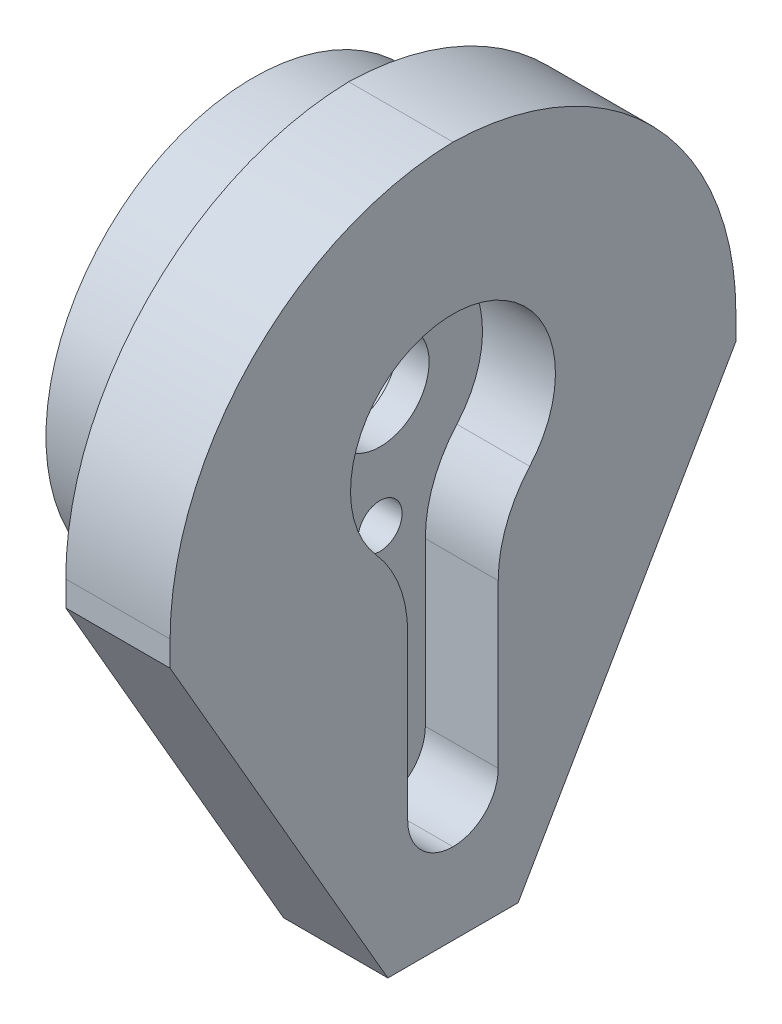
from build123d import *

# Parameters (mm, degrees)
SKETCH1_W           = 20
SKETCH1_H           = 20
BOSS_EXTRUDE1_DEPTH = 20
SKETCH2_W           = 45
SKETCH2_H           = 70
BOSS_EXTRUDE2_DEPTH = 8.3
CUT_EXTRUDE1_DEPTH  = 5.8
FILLET1_R           = 3.6
FILLET2_R           = 10
SKETCH5_R           = 3.9
CUT_EXTRUDE2_DEPTH  = 51.320373608
CUT_EXTRUDE3_REACH  = 49.302
SKETCH6_R           = 1.75
SKETCH13_W          = 20
SKETCH13_H          = 20
CUT_EXTRUDE9_DEPTH  = 20
SKETCH14_R          = 16.475
BOSS_EXTRUDE3_DEPTH = 7.6
SKETCH15_W          = 8.3
SKETCH15_H          = 45
CUT_EXTRUDE10_DEPTH = 15
FILLET3_R           = 23
CHAMFER1_SIZE       = 30
CHAMFER1_SIZE2      = 17.320508076
CHAMFER2_SIZE       = 30
CHAMFER2_SIZE2      = 17.320508076
SKETCH16_R          = 13.475
CUT_EXTRUDE11_DEPTH = 7.6
FILLET4_R           = 1


# Some blends are built 0.0001 mm under size
with BuildPart() as part:
    # Sketch1 → Boss-Extrude1 (new body)
    with BuildSketch(Plane(origin=(0, 0, 0), x_dir=(0, 0, -1), z_dir=(1, 0, 0))):
        Rectangle(SKETCH1_W, SKETCH1_H)
    extrude(amount=BOSS_EXTRUDE1_DEPTH)

    # Sketch2 → Boss-Extrude2 (add)
    with BuildSketch(Plane(origin=(20, 0, 0), x_dir=(0, 0, -1), z_dir=(1, 0, 0))):
        Rectangle(SKETCH2_W, SKETCH2_H)
    extrude(amount=BOSS_EXTRUDE2_DEPTH)

    # Sketch4 → Cut-Extrude1 (cut)
    with BuildSketch(Plane(origin=(28.3, 0, 0), x_dir=(0, 0, -1), z_dir=(1, 0, 0))):
        with BuildLine():
            Line((3.6, -28.55), (-3.6, -28.55))
            Line((-3.6, -28.55), (-3.6, -7.311805523))
            ThreePointArc((-3.6, -7.311805523), (0, 8.15), (3.6, -7.311805523))
            Line((3.6, -7.311805523), (3.6, -28.55))
        make_face()
    extrude(amount=-CUT_EXTRUDE1_DEPTH, mode=Mode.SUBTRACT)

    # Fillet1
    fillet1_edges = [part.edges().sort_by_distance(p)[0] for p in [
        (25.4, -28.55, 3.6),
        (25.4, -28.55, -3.6),
    ]]
    fillet(fillet1_edges, radius=FILLET1_R - 0.0001)  # a hair under: the kernel refuses the full size

    # Fillet2
    fillet2_edges = [part.edges().sort_by_distance(p)[0] for p in [
        (25.4, -7.311805523, 3.6),
        (25.4, -7.311805523, -3.6),
    ]]
    fillet(fillet2_edges, radius=FILLET2_R)

    # Sketch5 → Cut-Extrude2 (cut, through all)
    with BuildSketch(Plane.ZY):
        Circle(SKETCH5_R)
    extrude(amount=-CUT_EXTRUDE2_DEPTH, mode=Mode.SUBTRACT)

    # Sketch6 → Cut-Extrude3 (cut, up to next)
    with BuildSketch(Plane(origin=(22.5, 0, 0), x_dir=(0, 0, -1), z_dir=(1, 0, 0)), mode=Mode.PRIVATE) as cut_extrude3_sk1:
        with Locations((0, -20.6)):
            Circle(SKETCH6_R)
    cut_extrude3_tool1 = extrude(cut_extrude3_sk1.sketch, amount=-CUT_EXTRUDE3_REACH, mode=Mode.PRIVATE) & part.part
    # Sketch6 → Cut-Extrude3 (cut, up to next)
    with BuildSketch(Plane(origin=(22.5, 0, 0), x_dir=(0, 0, -1), z_dir=(1, 0, 0)), mode=Mode.PRIVATE) as cut_extrude3_sk2:
        with Locations((0, -9.35)):
            Circle(SKETCH6_R)
    cut_extrude3_tool2 = extrude(cut_extrude3_sk2.sketch, amount=-CUT_EXTRUDE3_REACH, mode=Mode.PRIVATE) & part.part
    add(cut_extrude3_tool1.solids().sort_by_distance((22.5, -20.6, 0))[0], mode=Mode.SUBTRACT)
    add(cut_extrude3_tool2.solids().sort_by_distance((22.5, -9.35, 0))[0], mode=Mode.SUBTRACT)

    # Sketch13 → Cut-Extrude9 (cut)
    with BuildSketch(Plane.ZY):
        Rectangle(SKETCH13_W, SKETCH13_H)
    extrude(amount=-CUT_EXTRUDE9_DEPTH, mode=Mode.SUBTRACT)

    # Sketch14 → Boss-Extrude3 (add)
    with BuildSketch(Plane.ZY.offset(-20)):
        with Locations(Location((0, 0, 0), (0, 0, 180))):
            Circle(SKETCH14_R)
    extrude(amount=BOSS_EXTRUDE3_DEPTH)

    # Sketch15 → Cut-Extrude10 (cut)
    with BuildSketch(Plane(origin=(0, 35, 0), x_dir=(1, 0, 0), z_dir=(0, 1, 0))):
        with Locations((24.15, 0)):
            Rectangle(SKETCH15_W, SKETCH15_H)
    extrude(amount=-CUT_EXTRUDE10_DEPTH, mode=Mode.SUBTRACT)

    # Fillet3
    # the kernel refuses this fillet: 23 mm, written as the material it takes off along each edge
    with BuildSketch(Plane(origin=(-37.5, 20, -22.5), x_dir=(0, -1, 0), z_dir=(1, 0, 0)), Plane(origin=(85.8, 20, 22.5), x_dir=(0, -1, 0), z_dir=(-1, 0, 0))) as fillet3_piece_1:
        with BuildLine():
            CenterArc((FILLET3_R, -FILLET3_R), FILLET3_R, 90, 90)
            Line((0, -FILLET3_R), (0, 0))
            Line((0, 0), (FILLET3_R, 0))
        make_face()
    extrude(amount=123.3, mode=Mode.SUBTRACT)

    # Chamfer1
    chamfer1_edges = [part.edges().sort_by_distance(p)[0] for p in [
        (24.15, -35, 22.5),
    ]]
    chamfer1_side = [part.faces().sort_by_distance(p)[0] for p in [
        (24.15, -19, 22.5),
    ]]
    chamfer(chamfer1_edges, length=CHAMFER1_SIZE, length2=CHAMFER1_SIZE2, reference=chamfer1_side[0])

    # Chamfer2
    chamfer2_edges = [part.edges().sort_by_distance(p)[0] for p in [
        (24.15, -35, -22.5),
    ]]
    chamfer2_side = [part.faces().sort_by_distance(p)[0] for p in [
        (24.15, -19, -22.5),
    ]]
    chamfer(chamfer2_edges, length=CHAMFER2_SIZE, length2=CHAMFER2_SIZE2, reference=chamfer2_side[0])

    # Sketch16 → Cut-Extrude11 (cut)
    with BuildSketch(Plane.ZY.offset(-12.4)):
        Circle(SKETCH16_R)
    extrude(amount=-CUT_EXTRUDE11_DEPTH, mode=Mode.SUBTRACT)

    # Fillet4
    fillet4_edges = [part.edges().sort_by_distance(p)[0] for p in [
        (20, 0, 16.475),
        (20, 0, -13.475),
    ]]
    fillet(fillet4_edges, radius=FILLET4_R)


solid = part.part
